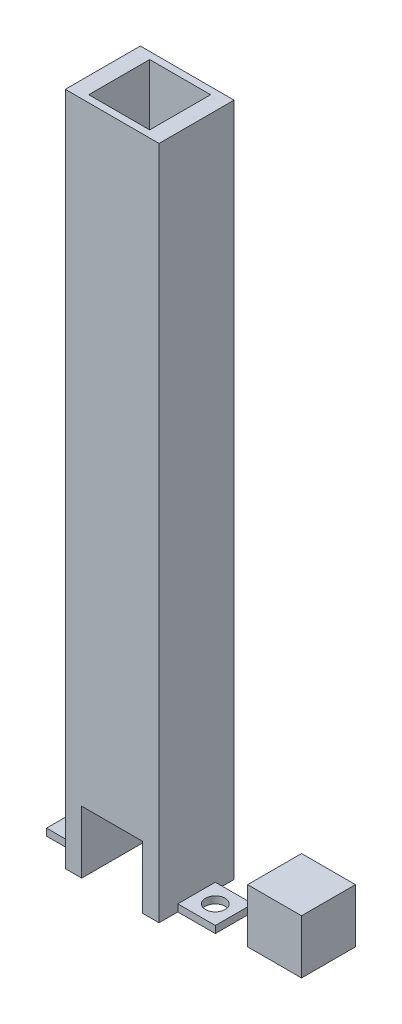
from build123d import *

# Parameters (mm, degrees)
SKETCH1_W           = 11.5
SKETCH1_H           = 11.5
BOSS_EXTRUDE1_DEPTH = 11.5
SKETCH2_W           = 20
SKETCH2_H           = 144
BOSS_EXTRUDE2_DEPTH = 16
SKETCH4_W           = 13
SKETCH4_H           = 13
CUT_EXTRUDE1_DEPTH  = 152.98237065
SKETCH5_W           = 13
SKETCH5_H           = 13.3
CUT_EXTRUDE2_DEPTH  = 1.5
SKETCH6_W           = 13
SKETCH6_H           = 8
CUT_EXTRUDE3_DEPTH  = 1.5
SKETCH7_W           = 8
SKETCH7_H           = 1.5
BOSS_EXTRUDE3_DEPTH = 8
SKETCH8_R           = 2.1
CUT_EXTRUDE4_DEPTH  = 10


with BuildPart() as part:
    # Sketch1 → Boss-Extrude1 (new body)
    with BuildSketch(Plane.XY):
        with Locations((-5.75, -5.75)):
            Rectangle(SKETCH1_W, SKETCH1_H)
    extrude(amount=BOSS_EXTRUDE1_DEPTH)


with BuildPart() as body_2:
    # Sketch2 → Boss-Extrude2 (new body)
    with BuildSketch(Plane.XY):
        with Locations((-35.898158877, 60)):
            Rectangle(SKETCH2_W, SKETCH2_H)
    extrude(amount=BOSS_EXTRUDE2_DEPTH)

    # Sketch4 → Cut-Extrude1 (cut, through all)
    with BuildSketch(Plane(origin=(0, 132, 0), x_dir=(1, 0, 0), z_dir=(0, 1, 0))):
        with Locations((-35.898158877, -8)):
            Rectangle(SKETCH4_W, SKETCH4_H)
    extrude(amount=-CUT_EXTRUDE1_DEPTH, mode=Mode.SUBTRACT)

    # Sketch5 → Cut-Extrude2 (cut)
    with BuildSketch(Plane.XY.offset(16)):
        with Locations((-35.898158877, -5.35)):
            Rectangle(SKETCH5_W, SKETCH5_H)
    extrude(amount=-CUT_EXTRUDE2_DEPTH, mode=Mode.SUBTRACT)

    # Sketch6 → Cut-Extrude3 (cut)
    with BuildSketch(Plane(origin=(0, 0, 0), x_dir=(-1, 0, 0), z_dir=(0, 0, -1))):
        with Locations((35.898158877, -8)):
            Rectangle(SKETCH6_W, SKETCH6_H)
    extrude(amount=-CUT_EXTRUDE3_DEPTH, mode=Mode.SUBTRACT)

    # Sketch7 → Boss-Extrude3 (add)
    with BuildSketch(Plane.ZY.offset(45.898158877)):
        with Locations((8, -11.25)):
            Rectangle(SKETCH7_W, SKETCH7_H)
    boss_extrude3 = extrude(amount=BOSS_EXTRUDE3_DEPTH)

    # Sketch8 → Cut-Extrude4 (cut)
    with BuildSketch(Plane(origin=(0, -10.5, 0), x_dir=(1, 0, 0), z_dir=(0, 1, 0))):
        with Locations((-49.898158877, -8)):
            Circle(SKETCH8_R)
    cut_extrude4 = extrude(amount=-CUT_EXTRUDE4_DEPTH, mode=Mode.SUBTRACT)

    # Mirror3: Boss-Extrude3, Cut-Extrude4 across plane
    add(boss_extrude3.mirror(Plane.ZY.offset(35.898158877)))
    add(cut_extrude4.mirror(Plane.ZY.offset(35.898158877)), mode=Mode.SUBTRACT)


solid = Compound([part.part, body_2.part])
